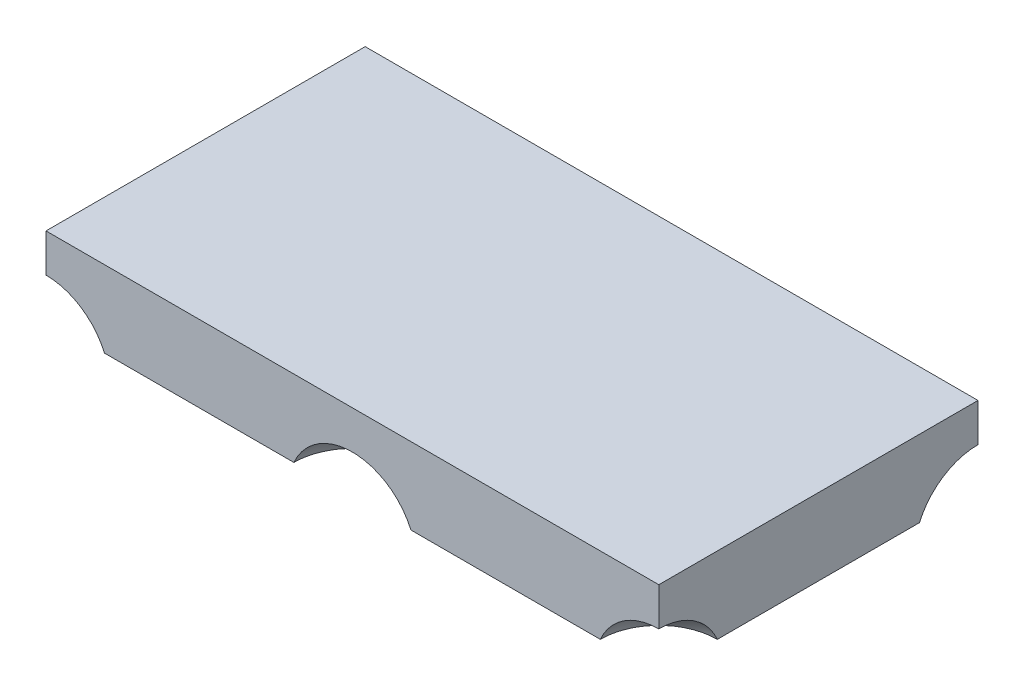
from build123d import *

# Parameters (mm, degrees)
SKETCH1_W           = 1219.2
SKETCH1_H           = 635
BOSS_EXTRUDE1_DEPTH = 152.4
LPATTERN3_COUNT     = 3
LPATTERN3_PITCH     = 609.6
LPATTERN3_2_COUNT   = 2
LPATTERN3_2_PITCH   = 635


with BuildPart() as part:
    # Sketch1 → Boss-Extrude1 (new body)
    with BuildSketch(Plane(origin=(0, 0, 0), x_dir=(1, 0, 0), z_dir=(0, 1, 0))):
        Rectangle(SKETCH1_W, SKETCH1_H)
    extrude(amount=BOSS_EXTRUDE1_DEPTH)


with BuildPart() as body_2:
    # Sketch3 → Revolve1 (revolve)
    with BuildSketch(Plane(origin=(0, -50.8, 0), x_dir=(-1, 0, 0), z_dir=(0, -1, 0))):
        with BuildLine():
            Line((-736.6, 317.5), (-482.6, 317.5))
            ThreePointArc((-482.6, 317.5), (-609.6, 444.5), (-736.6, 317.5))
        make_face()
    revolve(axis=Axis((-609.6, -50.8, -317.5), (1, 0, 0)))


with BuildPart() as lpattern3_1:
    # LPattern3: pattern copy
    add(body_2.part.moved(Location(Vector(-1, 0, 0) * (1 * LPATTERN3_PITCH))))


with BuildPart() as lpattern3_2:
    # LPattern3: pattern copy
    add(body_2.part.moved(Location(Vector(-1, 0, 0) * (2 * LPATTERN3_PITCH))))


with BuildPart() as lpattern3_2_1:
    # LPattern3 2: pattern copy
    add(body_2.part.moved(Location(Vector(0, 0, 1) * (1 * LPATTERN3_2_PITCH))))


with BuildPart() as lpattern3_2_2:
    # LPattern3 2: pattern copy
    add(lpattern3_1.part.moved(Location(Vector(0, 0, 1) * (1 * LPATTERN3_2_PITCH))))


with BuildPart() as lpattern3_2_3:
    # LPattern3 2: pattern copy
    add(lpattern3_2.part.moved(Location(Vector(0, 0, 1) * (1 * LPATTERN3_2_PITCH))))


with BuildPart() as part_1:
    add(part.part)

    # Intersect1: read off the stored shape, not the designer's step
    # Intersect1: cut body 2, LPattern3_1, LPattern3_2, LPattern3 2_1, LPattern3 2_2, LPattern3 2_3
    add(body_2.part, mode=Mode.SUBTRACT)
    add(lpattern3_1.part, mode=Mode.SUBTRACT)
    add(lpattern3_2.part, mode=Mode.SUBTRACT)
    add(lpattern3_2_1.part, mode=Mode.SUBTRACT)
    add(lpattern3_2_2.part, mode=Mode.SUBTRACT)
    add(lpattern3_2_3.part, mode=Mode.SUBTRACT)


solid = part_1.part
